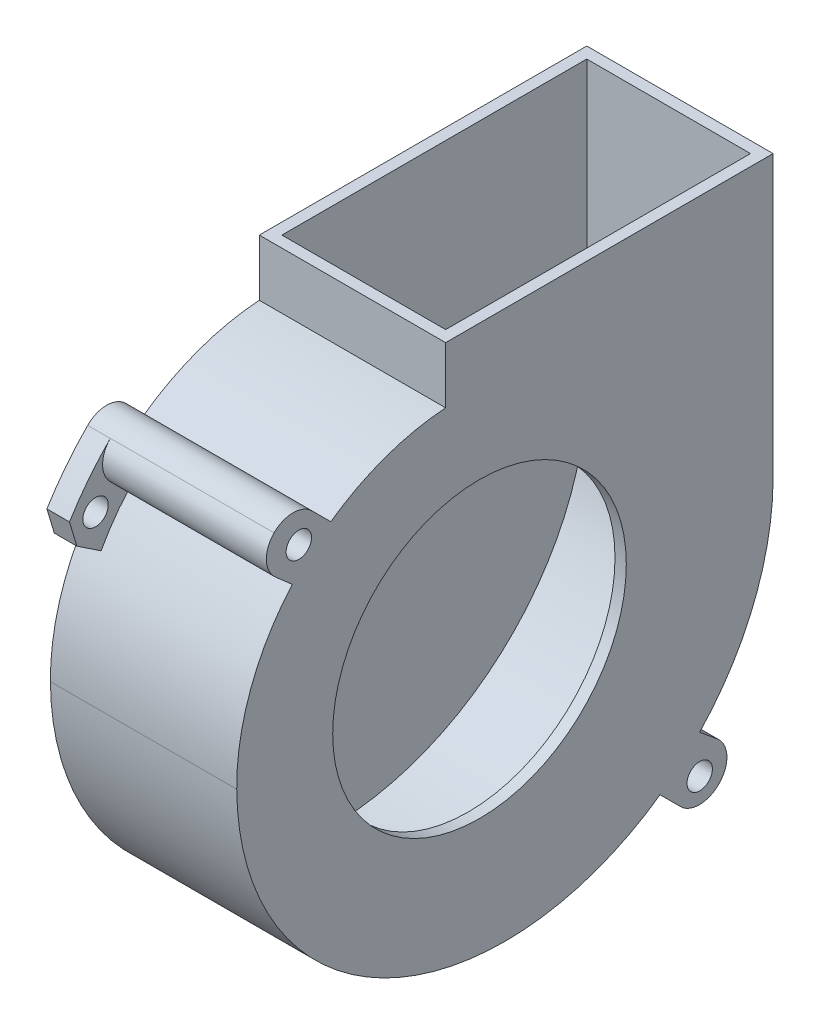
from build123d import *

# Parameters (mm, degrees)
SKETCH1_R               = 26
BOSS_EXTRUDE1_DEPTH     = 33
SHELL1_START            = 2
SHELL1_OUTLINE_R        = 28
SHELL1_DEPTH            = 29
SKETCH2_W               = 29
SKETCH2_H               = 54
CUT_EXTRUDE1_DEPTH      = 53
SKETCH3_R               = 26
BOSS_EXTRUDE2_DEPTH     = 2
SKETCH4_R               = 31.708367963
CUT_EXTRUDE2_DEPTH      = 29
SKETCH5_R               = 2.25
BOSS_EXTRUDE3_DEPTH     = 4
FILLET1_R               = 2
CHAMFER1_SIZE           = 3.326511139
BOSS_EXTRUDE4_START     = -33
BOSS_EXTRUDE4_OUTLINE_R = 2.25
BOSS_EXTRUDE4_DEPTH     = 33
FILLET2_R               = 4.75


with BuildPart() as part:
    # Sketch1 → Boss-Extrude1 (new body)
    with BuildSketch(Plane(origin=(0, 0, 0), x_dir=(0, 0, -1), z_dir=(1, 0, 0))):
        with BuildLine():
            Line((52, 0), (52, 50))
            Line((52, 50), (0, 50))
            Line((0, 50), (-6, 50))
            Line((-6, 50), (-6, 40))
            ThreePointArc((-6, 40), (-32.429333818, 27.334633781), (-43, 0))
            ThreePointArc((-43, 0), (4.5, -47.1), (52, 0))
        make_face()
        Circle(SKETCH1_R, mode=Mode.SUBTRACT)
    extrude(amount=BOSS_EXTRUDE1_DEPTH)

    # Shell1: read off the stored shape, not the designer's step
    # Shell1 outline → Shell1 (cut)
    with BuildSketch(Plane.YZ.offset(SHELL1_START)):
        with BuildLine():
            ThreePointArc((0.016913017, 41.000071514), (-45.099999808, -4.495817139), (0.0085476, -50))
            Line((0.0085476, -50), (48, -50))
            Line((48, -50), (48, 4))
            Line((48, 4), (38.088170021, 4))
            ThreePointArc((38.088170021, 4), (26.652605024, 30.320127965), (0.016913017, 41.000071514))
        make_face()
        Circle(SHELL1_OUTLINE_R, mode=Mode.SUBTRACT)
    extrude(amount=SHELL1_DEPTH, mode=Mode.SUBTRACT)

    # Sketch2 → Cut-Extrude1 (cut)
    with BuildSketch(Plane(origin=(0, 50, 0), x_dir=(1, 0, 0), z_dir=(0, 1, 0))):
        with Locations((16.5, 23)):
            Rectangle(SKETCH2_W, SKETCH2_H)
    extrude(amount=-CUT_EXTRUDE1_DEPTH, mode=Mode.SUBTRACT)

    # Sketch3 → Boss-Extrude2 (add)
    with BuildSketch(Plane.ZY):
        with Locations(Location((0, 0, 0), (0, 0, 81.150116902))):
            Circle(SKETCH3_R)
    extrude(amount=-BOSS_EXTRUDE2_DEPTH)

    # Sketch4 → Cut-Extrude2 (cut)
    with BuildSketch(Plane(origin=(31, 0, 0), x_dir=(0, 0, -1), z_dir=(1, 0, 0))):
        Circle(SKETCH4_R)
    extrude(amount=-CUT_EXTRUDE2_DEPTH, mode=Mode.SUBTRACT)

    # Sketch5 → Boss-Extrude3 (add)
    # profile 1 of 2: a face of its own
    with BuildSketch(Plane.ZY):
        with BuildLine():
            ThreePointArc((-51.418984108, -30.13414218), (-48.82497471, -34.177482297), (-45.913745602, -37.998768617))
            Line((-45.913745602, -37.998768617), (-38.477731669, -32.793558864))
            ThreePointArc((-38.477731669, -32.793558864), (-41.663875667, -29.183056126), (-44.468117742, -25.268535724))
            Line((-44.468117742, -25.268535724), (-51.418984108, -30.13414218))
        make_face()
        with Locations((-45, -31.5)):
            Circle(SKETCH5_R, mode=Mode.SUBTRACT)
    # profile 2 of 2: a face of its own
    with BuildSketch(Plane.ZY):
        with BuildLine():
            ThreePointArc((32.398527193, 27.367900169), (35.450790949, 23.647327492), (38.031195395, 19.585248223))
            Line((38.031195395, 19.585248223), (45.075911525, 24.281725643))
            ThreePointArc((45.075911525, 24.281725643), (42.60097507, 28.400650047), (39.750789641, 32.269408468))
            Line((39.750789641, 32.269408468), (32.398527193, 27.367900169))
        make_face()
        with Locations((39, 26)):
            Circle(SKETCH5_R, mode=Mode.SUBTRACT)
    extrude(amount=-BOSS_EXTRUDE3_DEPTH)

    # Fillet1
    fillet1_edges = [part.edges().sort_by_distance(p)[0] for p in [
        (2, -30.13414218, -51.418984108),
    ]]
    fillet(fillet1_edges, radius=FILLET1_R)

    # Chamfer1
    # the kernel refuses this chamfer: 3.326511139, 3 mm, written as the material it takes off along each edge
    with BuildSketch(Plane(origin=(-8.575137871, 24.281725643, 45.075911525), x_dir=(0, -0.5547001962252163, -0.8320502943378523), z_dir=(1, 0, 0))) as chamfer1_piece_1:
        with BuildLine():
            Line((CHAMFER1_SIZE, 0), (-0.190667191, 2.911795765))
            ThreePointArc((-0.190667191, 2.911795765), (-0.119044869, 1.500102705), (0, 0))
            Line((0, 0), (CHAMFER1_SIZE, 0))
        make_face()
    extrude(amount=21.150275743, mode=Mode.SUBTRACT)

    # Boss-Extrude4: read off the stored shape, not the designer's step
    # Boss-Extrude4 outline → Boss-Extrude4 (add)
    # profile 1 of 2: a face of its own
    with BuildSketch(Plane.ZY.offset(BOSS_EXTRUDE4_START)):
        with BuildLine():
            ThreePointArc((26.336648486, 32.700609517), (29.932721568, 29.805201706), (33.168906621, 26.512446886))
            Line((33.168906621, 26.512446886), (39.750789641, 32.269408468))
            ThreePointArc((39.750789641, 32.269408468), (36.48342014, 35.922138784), (32.881782461, 39.245743491))
            Line((32.881782461, 39.245743491), (26.336648486, 32.700609517))
        make_face()
        with Locations((32, 32)):
            Circle(BOSS_EXTRUDE4_OUTLINE_R, mode=Mode.SUBTRACT)
    # profile 2 of 2: a face of its own
    with BuildSketch(Plane.ZY.offset(BOSS_EXTRUDE4_START)):
        with BuildLine():
            Line((-38.840294261, -45.204092661), (-31.980263742, -38.344223418))
            ThreePointArc((-31.980263742, -38.344223418), (-35.639554577, -35.469452882), (-39, -32.250427936))
            Line((-39, -32.250427936), (-45.913745602, -37.998768617))
            ThreePointArc((-45.913745602, -37.998768617), (-42.529883516, -41.751496496), (-38.840294261, -45.204092661))
        make_face()
        with Locations((-39, -39)):
            Circle(BOSS_EXTRUDE4_OUTLINE_R, mode=Mode.SUBTRACT)
    extrude(amount=BOSS_EXTRUDE4_DEPTH)

    # Fillet2
    # the kernel refuses this fillet: 4.75 mm, written as the material it takes off along each edge
    with BuildSketch(Plane(origin=(45.884989722, -37.998768617, -45.913745602), x_dir=(0, -0.742095530004095, 0.6702941327118576), z_dir=(-1, 0, 0))) as fillet2_piece_1:
        with BuildLine():
            CenterArc((4.948609093, 4.745557529), FILLET2_R, 177.651602882, 94.826600607)
            Line((0.202598429, 4.940192516), (0, 0))
            ThreePointArc((0, 0), (2.576997944, -0.055739892), (5.153995889, 0))
        make_face()
    extrude(amount=41.884989722, mode=Mode.SUBTRACT)
    with BuildSketch(Plane(origin=(44.936529157, -45.204092661, -38.840294261), x_dir=(0, 0.6815583401392785, -0.7317637794989523), z_dir=(-1, 0, 0))) as fillet2_piece_2:
        with BuildLine():
            CenterArc((4.584343333, -4.746187729), FILLET2_R, 87.70431796, 90.260546116)
            Line((-0.162660545, -4.577504047), (0, 0))
            ThreePointArc((0, 0), (2.387305831, 0.047832742), (4.774611663, 0))
        make_face()
    extrude(amount=56.873058314, mode=Mode.SUBTRACT)
    with BuildSketch(Plane(origin=(44.949107529, 39.245743491, 32.881782461), x_dir=(0, -0.6773005061883329, 0.735706479730217), z_dir=(-1, 0, 0))) as fillet2_piece_3:
        with BuildLine():
            CenterArc((4.557931056, -4.744822843), FILLET2_R, 87.324678627, 90.308374896)
            Line((-0.188016347, -4.548651358), (0, 0))
            ThreePointArc((0, 0), (2.389821506, 0.055804306), (4.779643012, 0))
        make_face()
    extrude(amount=56.898215059, mode=Mode.SUBTRACT)
    with BuildSketch(Plane(origin=(45.609389119, 32.269408468, 39.750789641), x_dir=(0, -0.6583630051662173, -0.7527005735539911), z_dir=(-1, 0, 0))) as fillet2_piece_4:
        with BuildLine():
            CenterArc((4.804098652, -4.75), FILLET2_R, 90, 93.540841906)
            ThreePointArc((0.06316627, -5.043360096), (-0.030557791, -2.522458341), (0, 0))
            Line((0, 0), (4.804098652, 0))
        make_face()
    extrude(amount=41.609389119, mode=Mode.SUBTRACT)


solid = part.part
